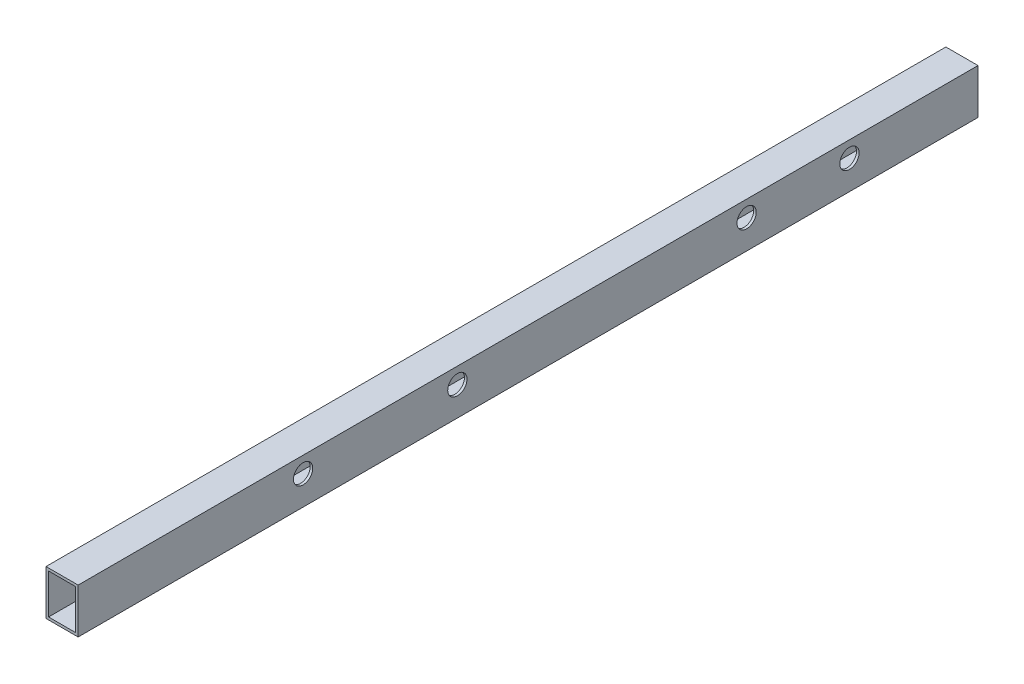
from build123d import *

# Parameters (mm, degrees)
SKETCH1_W           = 50
SKETCH1_H           = 70
SKETCH1_W_2         = 42
SKETCH1_H_2         = 62
BOSS_EXTRUDE2_DEPTH = 1400
SKETCH2_R           = 15
CUT_EXTRUDE1_DEPTH  = 1403.640367307


with BuildPart() as part:
    # Sketch1 → Boss-Extrude2 (new body)
    with BuildSketch(Plane.XY):
        with Locations((25, -35)):
            Rectangle(SKETCH1_W, SKETCH1_H)
        with Locations((25, -35)):
            Rectangle(SKETCH1_W_2, SKETCH1_H_2, mode=Mode.SUBTRACT)
    extrude(amount=BOSS_EXTRUDE2_DEPTH)

    # Sketch2 → Cut-Extrude1 (cut, through all)
    with BuildSketch(Plane(origin=(50, 0, 0), x_dir=(0, 0, -1), z_dir=(1, 0, 0))):
        with Locations((-1050, -25)):
            Circle(SKETCH2_R)
        with Locations((-200, -25)):
            Circle(SKETCH2_R)
        with Locations((-810, -25)):
            Circle(SKETCH2_R)
        with Locations((-360, -25)):
            Circle(SKETCH2_R)
    extrude(amount=-CUT_EXTRUDE1_DEPTH, mode=Mode.SUBTRACT)


solid = part.part
